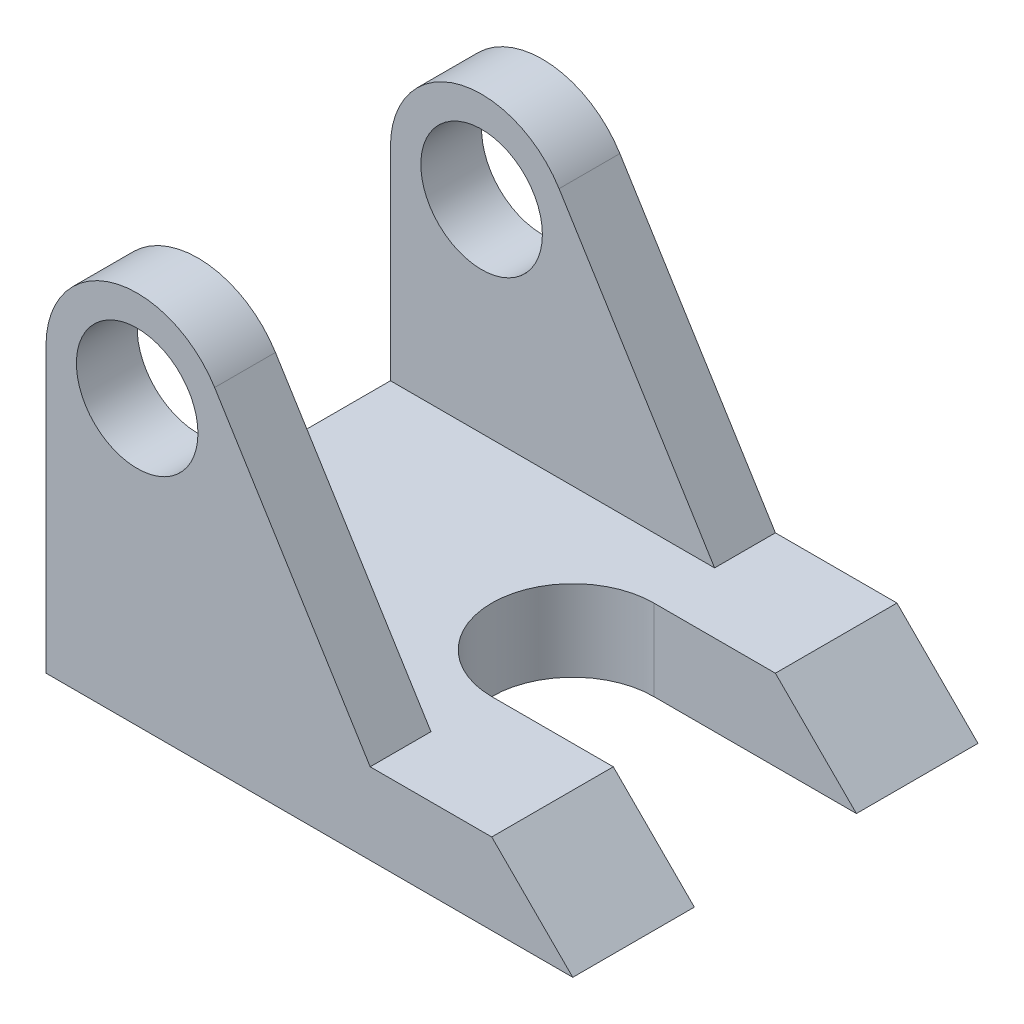
from build123d import *

# Parameters (mm, degrees)
BOSS_EXTRUDE1_DEPTH      = 50
BOSS_EXTRUDE1_DEPTH_BACK = 50
CUT_EXTRUDE1_DEPTH       = 141.712472795
CUT_EXTRUDE1_DEPTH_BACK  = 141.712472795
SKETCH3_R                = 15
BOSS_EXTRUDE2_DEPTH      = 100
CUT_EXTRUDE2_DEPTH       = 35
CUT_EXTRUDE2_DEPTH_BACK  = 35


with BuildPart() as part:
    # Sketch1 → Boss-Extrude1 (new, two sides: drawn at the far end of the back side and taken through both)
    with BuildSketch(Plane.XY.offset(-BOSS_EXTRUDE1_DEPTH_BACK)):
        Polygon((0, 0), (0, 20), (110, 20), (130, 0), align=None)
    extrude(amount=BOSS_EXTRUDE1_DEPTH + BOSS_EXTRUDE1_DEPTH_BACK)

    # Sketch2 → Cut-Extrude1 (cut, two sides: drawn at the far end of the back side and taken through both)
    with BuildSketch(Plane(origin=(0, 20, 0), x_dir=(1, 0, 0), z_dir=(0, 1, 0)).offset(-CUT_EXTRUDE1_DEPTH_BACK)):
        with BuildLine():
            Line((435.296461205, -20), (130, -20))
            Line((130, -20), (80, -20))
            ThreePointArc((80, -20), (60, 0), (80, 20))
            Line((80, 20), (130, 20))
            Line((130, 20), (435.296461205, 20))
            Line((435.296461205, 20), (1045.889383614, 20))
            Line((1045.889383614, 20), (1045.889383614, -20))
            Line((1045.889383614, -20), (435.296461205, -20))
        make_face()
    extrude(amount=CUT_EXTRUDE1_DEPTH + CUT_EXTRUDE1_DEPTH_BACK, mode=Mode.SUBTRACT)

    # Sketch3 → Boss-Extrude2 (add)
    with BuildSketch(Plane.XY.offset(50)):
        with BuildLine():
            Line((0, 70), (0, 20))
            Line((0, 20), (80, 20))
            Line((80, 20), (41.61915802, 81.862031723))
            ThreePointArc((41.61915802, 81.862031723), (16.33279056, 91.638288466), (0, 70))
        make_face()
        with Locations((22.5, 70)):
            Circle(SKETCH3_R, mode=Mode.SUBTRACT)
    extrude(amount=-BOSS_EXTRUDE2_DEPTH)

    # Sketch7 → Cut-Extrude2 (cut, two sides: drawn at the far end of the back side and taken through both)
    with BuildSketch(Plane.XY.offset(-CUT_EXTRUDE2_DEPTH_BACK)):
        with BuildLine():
            Line((80, 20), (0, 20))
            Line((0, 20), (0, 70))
            ThreePointArc((0, 70), (16.33279056, 91.638288466), (41.61915802, 81.862031723))
            Line((41.61915802, 81.862031723), (80, 20))
        make_face()
    extrude(amount=CUT_EXTRUDE2_DEPTH + CUT_EXTRUDE2_DEPTH_BACK, mode=Mode.SUBTRACT)


solid = part.part
